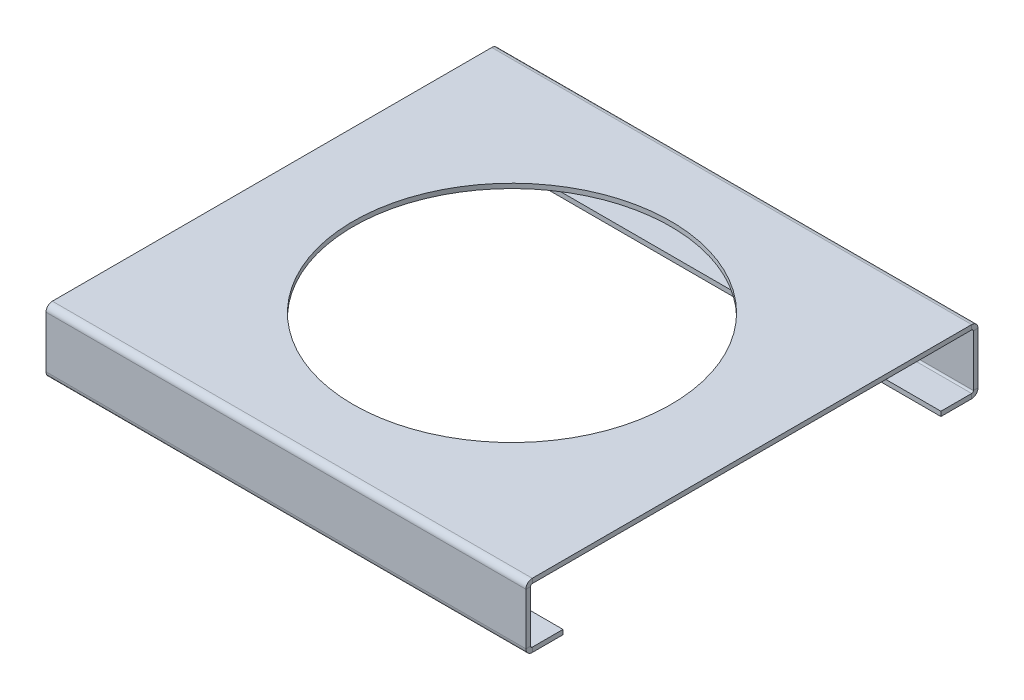
from build123d import *

# Parameters (mm, degrees)
SKETCH3_W                      = 207
SKETCH3_H                      = 195
BASE_FLANGE1_DEPTH             = 2
EDGE_FLANGE1_STRIP_W           = 9.4732
EDGE_FLANGE1_STRIP_H           = 2
EDGE_FLANGE1_STRIP_CUT_DEPTH   = 207
EDGE_FLANGE1_STRIP_2_W         = 9.4732
EDGE_FLANGE1_STRIP_2_H         = 2
EDGE_FLANGE1_STRIP_CUT_2_DEPTH = 207
EDGE_FLANGE1_DEPTH             = 207
EDGE_FLANGE1_BEND_DEPTH        = 207
SKETCH14_R                     = 68.5
CUT_EXTRUDE1_DEPTH             = 2
EDGE_FLANGE2_DEPTH             = 207
EDGE_FLANGE2_BEND_DEPTH        = 207


# Sheet-metal steps are written as plain solids
with BuildPart() as part:
    # Sketch3 → Base-Flange1 (new body)
    with BuildSketch(Plane(origin=(0, 0, 0), x_dir=(1, 0, 0), z_dir=(0, 1, 0))):
        with Locations((-1.354892482, -0.135489248)):
            Rectangle(SKETCH3_W, SKETCH3_H)
    extrude(amount=-BASE_FLANGE1_DEPTH)

    # Edge-Flange1 strip (across the edge) → Edge-Flange1 strip cut (cut)
    with BuildSketch(Plane(origin=(102.145107518, -2, 97.635489248), x_dir=(0, 0, -1), z_dir=(-1, 0, 0))):
        with Locations((-2, -1)):
            Rectangle(EDGE_FLANGE1_STRIP_W, EDGE_FLANGE1_STRIP_H)
    extrude(amount=EDGE_FLANGE1_STRIP_CUT_DEPTH, mode=Mode.SUBTRACT)

    # Edge-Flange1 strip 2 (across the edge) → Edge-Flange1 strip cut 2 (cut)
    with BuildSketch(Plane(origin=(-104.854892482, -2, -97.364510752), x_dir=(0, 0, 1), z_dir=(1, 0, 0))):
        with Locations((-2, -1)):
            Rectangle(EDGE_FLANGE1_STRIP_2_W, EDGE_FLANGE1_STRIP_2_H)
    extrude(amount=EDGE_FLANGE1_STRIP_CUT_2_DEPTH, mode=Mode.SUBTRACT)

    # Edge-Flange1 section (across the edge) → Edge-Flange1 (add)
    with BuildSketch(Plane(origin=(102.145107518, -2, 97.635489248), x_dir=(0, 0, -1), z_dir=(-1, 0, 0))):
        with BuildLine():
            Line((0, 0.7366), (0, 23))
            Line((0, 23), (2, 23))
            Line((2, 23), (2, 0.7366))
            ThreePointArc((2, 0.7366), (2.215745145, 0.215745145), (2.7366, 0))
            Line((2.7366, 0), (2.7366, -2))
            ThreePointArc((2.7366, -2), (0.801531583, -1.198468417), (0, 0.7366))
        make_face()
    extrude(amount=EDGE_FLANGE1_DEPTH)

    # Edge-Flange1 section 2 (across the edge) → Edge-Flange1 bend (add)
    with BuildSketch(Plane(origin=(-104.854892482, -2, -97.364510752), x_dir=(0, 0, 1), z_dir=(1, 0, 0))):
        with BuildLine():
            Line((0, 0.7366), (0, 23))
            Line((0, 23), (2, 23))
            Line((2, 23), (2, 0.7366))
            ThreePointArc((2, 0.7366), (2.215745145, 0.215745145), (2.7366, 0))
            Line((2.7366, 0), (2.7366, -2))
            ThreePointArc((2.7366, -2), (0.801531583, -1.198468417), (0, 0.7366))
        make_face()
    extrude(amount=EDGE_FLANGE1_BEND_DEPTH)

    # Sketch14 → Cut-Extrude1 (cut)
    with BuildSketch(Plane(origin=(0, 0, 0), x_dir=(1, 0, 0), z_dir=(0, 1, 0))):
        with Locations(Location((-1.354892482, -0.135489248, 0), (0, 0, 270))):
            Circle(SKETCH14_R)
    extrude(amount=-CUT_EXTRUDE1_DEPTH, mode=Mode.SUBTRACT)

    # Edge-Flange2 section (across the edge) → Edge-Flange2 (add)
    with BuildSketch(Plane(origin=(102.145107518, -25.7366, 95.635489248), x_dir=(0, 1, 0), z_dir=(-1, 0, 0))):
        with BuildLine():
            Line((-2, 0.7366), (-2, 14))
            Line((-2, 14), (0, 14))
            Line((0, 14), (0, 0.7366))
            ThreePointArc((0, 0.7366), (0.215745145, 0.215745145), (0.7366, 0))
            Line((0.7366, 0), (0.7366, -2))
            ThreePointArc((0.7366, -2), (-1.198468417, -1.198468417), (-2, 0.7366))
        make_face()
    extrude(amount=EDGE_FLANGE2_DEPTH)

    # Edge-Flange2 section 2 (across the edge) → Edge-Flange2 bend (add)
    with BuildSketch(Plane(origin=(-104.854892482, -25.7366, -95.364510752), x_dir=(0, 1, 0), z_dir=(1, 0, 0))):
        with BuildLine():
            Line((-2, 0.7366), (-2, 14))
            Line((-2, 14), (0, 14))
            Line((0, 14), (0, 0.7366))
            ThreePointArc((0, 0.7366), (0.215745145, 0.215745145), (0.7366, 0))
            Line((0.7366, 0), (0.7366, -2))
            ThreePointArc((0.7366, -2), (-1.198468417, -1.198468417), (-2, 0.7366))
        make_face()
    extrude(amount=EDGE_FLANGE2_BEND_DEPTH)


solid = part.part
